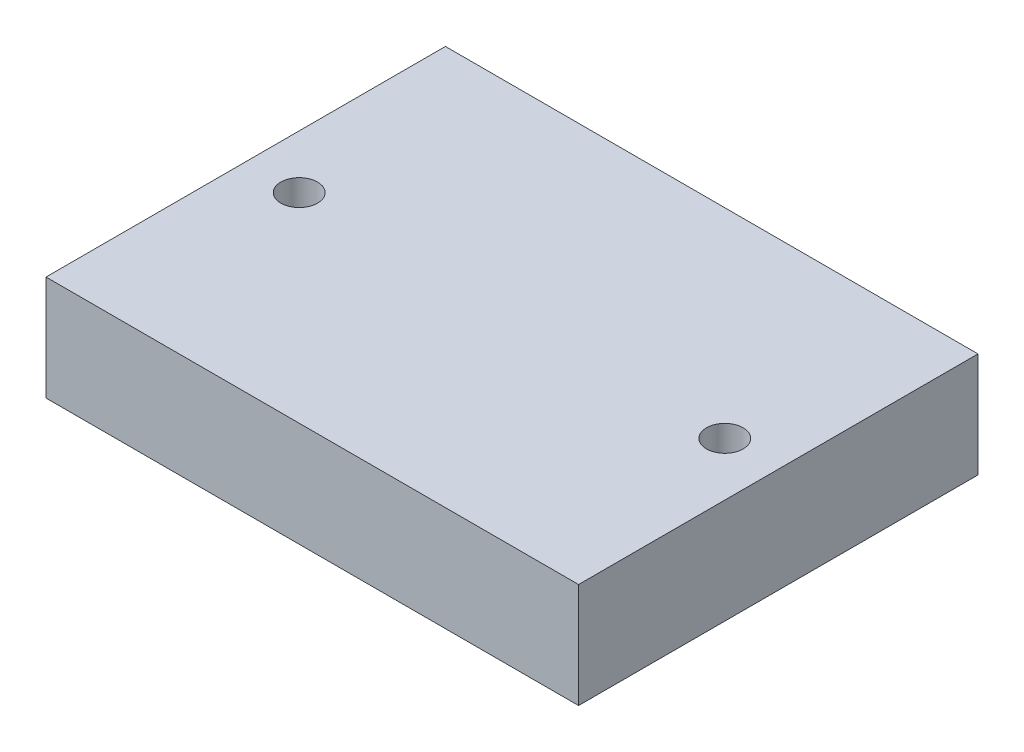
from build123d import *

# Parameters (mm, degrees)
SKETCH1_W           = 50.8
SKETCH1_H           = 38.1
SKETCH1_R           = 1.75
BOSS_EXTRUDE1_DEPTH = 10


with BuildPart() as part:
    # Sketch1 → Boss-Extrude1 (new body)
    with BuildSketch(Plane(origin=(0, 0, 0), x_dir=(1, 0, 0), z_dir=(0, 1, 0))):
        with Locations((25.4, 19.05)):
            Rectangle(SKETCH1_W, SKETCH1_H)
        with Locations((5.1, 19.05)):
            Circle(SKETCH1_R, mode=Mode.SUBTRACT)
        with Locations((45.7, 19.05)):
            Circle(SKETCH1_R, mode=Mode.SUBTRACT)
    extrude(amount=BOSS_EXTRUDE1_DEPTH)


solid = part.part
